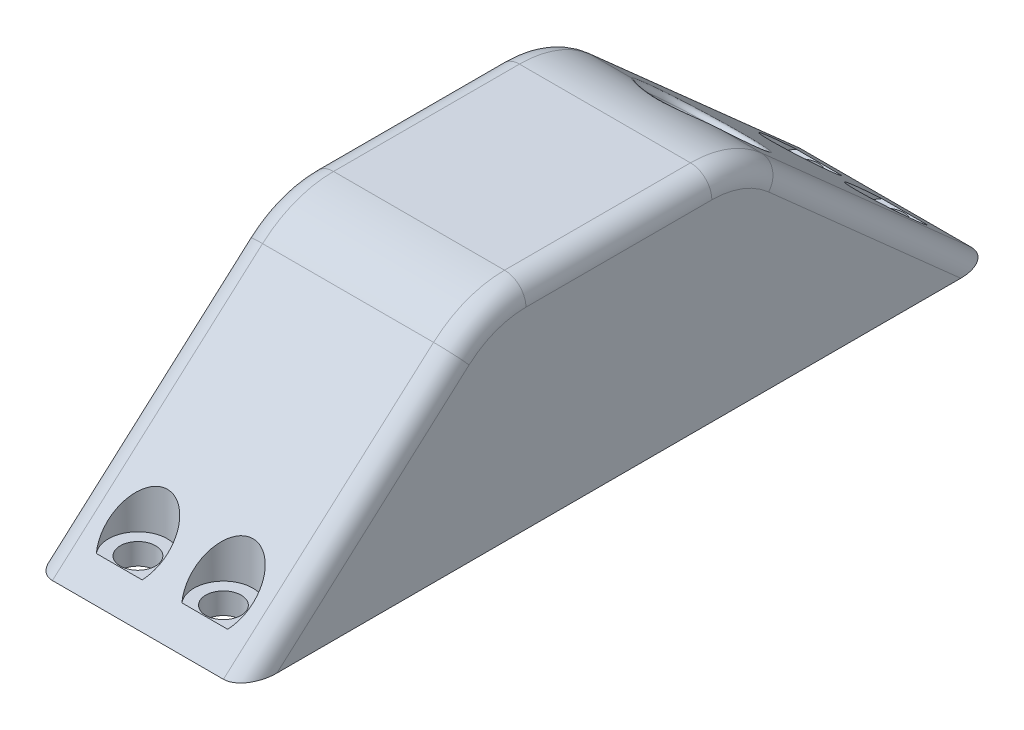
from build123d import *

# Parameters (mm, degrees)
BOSS_EXTRUDE1_DEPTH = 20
FILLET1_R           = 2
SKETCH3_W           = 14.1
SKETCH3_H           = 19.5
CUT_EXTRUDE1_DEPTH  = 34
SKETCH4_R           = 4.75
CUT_EXTRUDE2_DEPTH  = 20
SKETCH4_5_W         = 11.9
SKETCH4_5_H         = 11.8
SKETCH4_5_R         = 4.75
CUT_EXTRUDE3_DEPTH  = 11
SKETCH4_6_W         = 14.1
SKETCH4_6_H         = 13
SKETCH4_6_W_2       = 11.9
SKETCH4_6_H_2       = 11.8
CUT_EXTRUDE4_DEPTH  = 5.3
SKETCH4_8_W         = 14.1
SKETCH4_8_H         = 17
CUT_EXTRUDE5_DEPTH  = 2
FILLET2_R           = 0.5
SKETCH7_R           = 1.65
CUT_EXTRUDE7_DEPTH  = 15
SKETCH7_3_R         = 2.765
SKETCH7_3_R_2       = 1.65
CUT_EXTRUDE8_DEPTH  = 8


with BuildPart() as part:
    # Sketch2 → Boss-Extrude1 (new body)
    with BuildSketch(Plane(origin=(0, 0, 0), x_dir=(0, 0, -1), z_dir=(1, 0, 0))):
        with BuildLine():
            Line((-35, 0), (35, 0))
            Line((35, 0), (15.341645165, 17.474093187))
            ThreePointArc((15.341645165, 17.474093187), (12.251812352, 19.347217015), (8.698006777, 20))
            Line((8.698006777, 20), (-8.698006777, 20))
            ThreePointArc((-8.698006777, 20), (-12.251812352, 19.347217015), (-15.341645165, 17.474093187))
            Line((-15.341645165, 17.474093187), (-35, 0))
        make_face()
    extrude(amount=BOSS_EXTRUDE1_DEPTH)

    # Fillet1
    fillet1_edges = [part.edges().sort_by_distance(p)[0] for p in [
        (20, 8.737046593, -25.170822582),
        (20, 19.347217015, -12.251812352),
        (20, 8.737046593, 25.170822582),
        (20, 19.347217015, 12.251812352),
        (20, 20, 0),
        (0, 8.737046593, -25.170822582),
        (0, 19.347217015, -12.251812352),
        (0, 20, 0),
        (0, 19.347217015, 12.251812352),
        (0, 8.737046593, 25.170822582),
    ]]
    fillet(fillet1_edges, radius=FILLET1_R)

    # Sketch3 → Cut-Extrude1 (cut)
    with BuildSketch(Plane(origin=(0, -17.379310345, -19.551724138), x_dir=(-1, 0, 0), z_dir=(0, -0.6643638388299198, -0.7474093186836597))):
        with Locations((-10, 0.502734359)):
            Rectangle(SKETCH3_W, SKETCH3_H)
    extrude(amount=-CUT_EXTRUDE1_DEPTH, mode=Mode.SUBTRACT)

    # Sketch4 → Cut-Extrude2 (cut)
    with BuildSketch(Plane(origin=(0, 7.662989202, -6.811545957), x_dir=(1, 0, 0), z_dir=(0, -0.7474093186836597, 0.6643638388299198))):
        with Locations((10, -3.034326154)):
            Circle(SKETCH4_R)
    extrude(amount=-CUT_EXTRUDE2_DEPTH, mode=Mode.SUBTRACT)

    # Sketch4<5> → Cut-Extrude3 (cut)
    with BuildSketch(Plane(origin=(0, 7.662989202, -6.811545957), x_dir=(1, 0, 0), z_dir=(0, -0.7474093186836597, 0.6643638388299198))):
        with Locations((10, -3.034326154)):
            Rectangle(SKETCH4_5_W, SKETCH4_5_H)
        with Locations((10, -3.034326154)):
            Circle(SKETCH4_5_R, mode=Mode.SUBTRACT)
    extrude(amount=-CUT_EXTRUDE3_DEPTH, mode=Mode.SUBTRACT)

    # Sketch4<6> → Cut-Extrude4 (cut)
    with BuildSketch(Plane(origin=(0, 7.662989202, -6.811545957), x_dir=(1, 0, 0), z_dir=(0, -0.7474093186836597, 0.6643638388299198))):
        with Locations((10, -3.034326154)):
            Rectangle(SKETCH4_6_W, SKETCH4_6_H)
        with Locations((10, -3.034326154)):
            Rectangle(SKETCH4_6_W_2, SKETCH4_6_H_2, mode=Mode.SUBTRACT)
    extrude(amount=-CUT_EXTRUDE4_DEPTH, mode=Mode.SUBTRACT)

    # Sketch4<8> → Cut-Extrude5 (cut)
    with BuildSketch(Plane(origin=(0, 7.662989202, -6.811545957), x_dir=(1, 0, 0), z_dir=(0, -0.7474093186836597, 0.6643638388299198))):
        with Locations((10, -3.034326154)):
            Rectangle(SKETCH4_8_W, SKETCH4_8_H)
    extrude(amount=-CUT_EXTRUDE5_DEPTH, mode=Mode.SUBTRACT)

    # Fillet2
    fillet2_edges = [part.edges().sort_by_distance(p)[0] for p in [
        (8.298617151, 12.417067152, -21.030799454),
        (10, 18.426095202, -14.08325697),
    ]]
    fillet(fillet2_edges, radius=FILLET2_R)

    # Sketch7 → Cut-Extrude7 (cut)
    with BuildSketch(Plane(origin=(0, 10, 0), x_dir=(1, 0, 0), z_dir=(0, 1, 0))):
        with Locations((14, 31)):
            Circle(SKETCH7_R)
        with Locations((6, 31)):
            Circle(SKETCH7_R)
        with Locations((14, -31)):
            Circle(SKETCH7_R)
        with Locations((6, -31)):
            Circle(SKETCH7_R)
    extrude(amount=-CUT_EXTRUDE7_DEPTH, mode=Mode.SUBTRACT)

    # Sketch7<3> → Cut-Extrude8 (cut)
    # profile 1 of 4: a face of its own
    with BuildSketch(Plane(origin=(0, 10, 0), x_dir=(1, 0, 0), z_dir=(0, 1, 0))):
        with Locations((6, 31)):
            Circle(SKETCH7_3_R)
    # profile 2 of 4: a face of its own
    with BuildSketch(Plane(origin=(0, 10, 0), x_dir=(1, 0, 0), z_dir=(0, 1, 0))):
        with Locations((14, 31)):
            Circle(SKETCH7_3_R)
        with Locations((14, 31)):
            Circle(SKETCH7_3_R_2, mode=Mode.SUBTRACT)
    # profile 3 of 4: a face of its own
    with BuildSketch(Plane(origin=(0, 10, 0), x_dir=(1, 0, 0), z_dir=(0, 1, 0))):
        with Locations((6, -31)):
            Circle(SKETCH7_3_R)
        with Locations((6, -31)):
            Circle(SKETCH7_3_R_2, mode=Mode.SUBTRACT)
    # profile 4 of 4: a face of its own
    with BuildSketch(Plane(origin=(0, 10, 0), x_dir=(1, 0, 0), z_dir=(0, 1, 0))):
        with Locations((14, -31)):
            Circle(SKETCH7_3_R)
        with Locations((14, -31)):
            Circle(SKETCH7_3_R_2, mode=Mode.SUBTRACT)
    extrude(amount=-CUT_EXTRUDE8_DEPTH, mode=Mode.SUBTRACT)


solid = part.part
